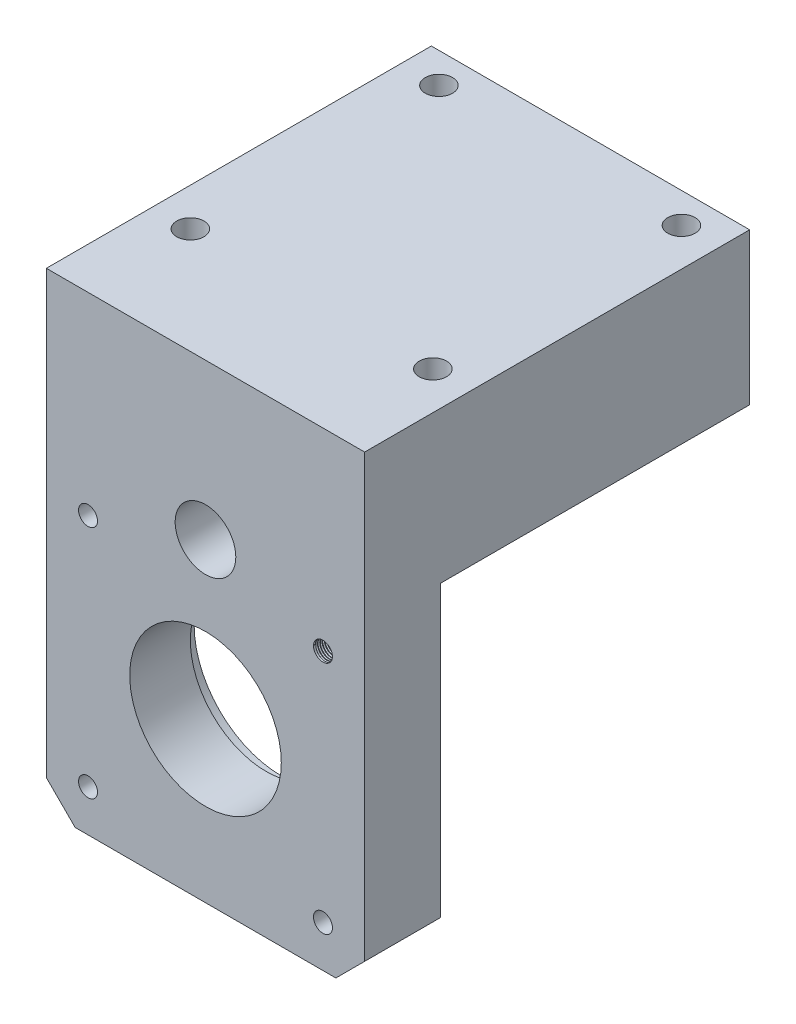
from build123d import *

# Parameters (mm, degrees)
SKETCH1_W                     = 42
SKETCH1_H                     = 42
SKETCH1_R                     = 1.25
SKETCH1_R_2                   = 11.5
BOSS_EXTRUDE1_DEPTH           = 2
SKETCH2_W                     = 42
SKETCH2_H                     = 42.8
BOSS_EXTRUDE2_DEPTH           = 15
SKETCH4_W                     = 42
SKETCH4_H                     = 57
SKETCH4_R                     = 1.25
SKETCH4_R_2                   = 10
BOSS_EXTRUDE9_DEPTH           = 8
SKETCH6_R                     = 4
CUT_EXTRUDE3_DEPTH            = 12
THREAD1_PITCH                 = 0.3
CHAMFER1_SIZE                 = 3.8
SKETCH7_W                     = 42
SKETCH7_H                     = 50.8
BOSS_EXTRUDE10_DEPTH          = 5
CSK_FOR_M3_SFHCS1_D           = 3.6
CSK_FOR_M3_SFHCS1_CSINK_D     = 6.72
CSK_FOR_M3_SFHCS1_CSINK_ANGLE = 90
MIRROR4_COPY_1_D              = 3.6
MIRROR4_COPY_1_CSINK_D        = 6.72
MIRROR4_COPY_1_CSINK_ANGLE    = 90


with BuildPart() as part:
    # Sketch1 → Boss-Extrude1 (new body)
    with BuildSketch(Plane.XY):
        Rectangle(SKETCH1_W, SKETCH1_H)
        with Locations((15.5, 15.5)):
            Circle(SKETCH1_R, mode=Mode.SUBTRACT)
        with Locations((-15.5, 15.5)):
            Circle(SKETCH1_R, mode=Mode.SUBTRACT)
        with Locations((-15.5, -15.5)):
            Circle(SKETCH1_R, mode=Mode.SUBTRACT)
        with Locations((15.5, -15.5)):
            Circle(SKETCH1_R, mode=Mode.SUBTRACT)
        Circle(SKETCH1_R_2, mode=Mode.SUBTRACT)
    extrude(amount=BOSS_EXTRUDE1_DEPTH)

    # Sketch2 → Boss-Extrude2 (add)
    with BuildSketch(Plane(origin=(0, 21, 0), x_dir=(1, 0, 0), z_dir=(0, 1, 0))):
        with Locations((0, 19.4)):
            Rectangle(SKETCH2_W, SKETCH2_H)
    extrude(amount=BOSS_EXTRUDE2_DEPTH)

    # Sketch4 → Boss-Extrude9 (add)
    with BuildSketch(Plane.XY.offset(2)):
        with Locations((0, 7.5)):
            Rectangle(SKETCH4_W, SKETCH4_H)
        with Locations((-15.5, -15.5)):
            Circle(SKETCH4_R, mode=Mode.SUBTRACT)
        with Locations((15.5, -15.5)):
            Circle(SKETCH4_R, mode=Mode.SUBTRACT)
        with Locations((15.5, 15.5)):
            Circle(SKETCH4_R, mode=Mode.SUBTRACT)
        with Locations((-15.5, 15.5)):
            Circle(SKETCH4_R, mode=Mode.SUBTRACT)
        Circle(SKETCH4_R_2, mode=Mode.SUBTRACT)
    extrude(amount=BOSS_EXTRUDE9_DEPTH)

    # Sketch6 → Cut-Extrude3 (cut)
    with BuildSketch(Plane.XY.offset(10)):
        with Locations((0, 20.5)):
            Circle(SKETCH6_R)
    extrude(amount=-CUT_EXTRUDE3_DEPTH, mode=Mode.SUBTRACT)

    # Thread1: the profile of Thread Profile1 profile screwed along a right-hand helix of 33.333333 turns, 6 arcs to a turn; built about Z, then put on its axis
    thread1_z = Axis((0, 0, 0), (0, 0, 1))
    thread1_corners = [(1.2497, 0, -0.000173205), (1.412379763, 0, 0.09375), (1.412379763, 0, 0.13125), (1.2497, 0, 0.225173204)]
    with BuildLine(mode=Mode.PRIVATE) as thread1_profile:
        Line(thread1_corners[0], thread1_corners[1])
        Line(thread1_corners[1], thread1_corners[2])
        Line(thread1_corners[2], thread1_corners[3])
        Line(thread1_corners[3], thread1_corners[0])
    thread1_cap = Face(thread1_profile.wire())
    thread1_turn_angles = [0, 30, 60, 90, 120, 150, 180, 210, 240, 270, 300, 330, 360]
    thread1_turn_weights = [1, 0.8660254037844387, 1, 0.8660254037844387, 1, 0.8660254037844387, 1, 0.8660254037844387, 1, 0.8660254037844387, 1, 0.8660254037844387, 1]
    thread1_turn_rails = [Edge.make_bspline([Vector(p[0], p[1], 0).rotate(thread1_z, thread1_turn_angles[k]) / thread1_turn_weights[k] + Vector(0, 0, p[2] + THREAD1_PITCH * thread1_turn_angles[k] / 360) for k in range(13)], [0, 0, 0, 1, 1, 2, 2, 3, 3, 4, 4, 5, 5, 6, 6, 6], 2, thread1_turn_weights) for p in thread1_corners]
    thread1_turn_sides = [Face.make_surface_from_curves(thread1_turn_rails[p[0]], thread1_turn_rails[p[1]]) for p in [(0, 1), (1, 2), (2, 3), (3, 0)]]
    thread1_last_angles = [11880, 11910, 11940, 11970, 12000]
    thread1_last_weights = [1, 0.8660254037844387, 1, 0.8660254037844387, 1]
    thread1_last_rails = [Edge.make_bspline([Vector(p[0], p[1], 0).rotate(thread1_z, thread1_last_angles[k]) / thread1_last_weights[k] + Vector(0, 0, p[2] + THREAD1_PITCH * thread1_last_angles[k] / 360) for k in range(5)], [0, 0, 0, 1, 1, 2, 2, 2], 2, thread1_last_weights) for p in thread1_corners]
    thread1_last_sides = [Face.make_surface_from_curves(thread1_last_rails[p[0]], thread1_last_rails[p[1]]) for p in [(0, 1), (1, 2), (2, 3), (3, 0)]]
    thread1 = Plane(origin=(15.5, 15.5, 10), x_dir=(-1, 0, 0), z_dir=(0, 0, -1)) * Solid(Shell([*[p.moved(Location((0, 0, THREAD1_PITCH * i))) for i in range(33) for p in thread1_turn_sides], *thread1_last_sides, thread1_cap, thread1_cap.rotate(thread1_z, 12000).moved(Location((0, 0, THREAD1_PITCH * 12000 / 360)))]))
    add(thread1, mode=Mode.SUBTRACT)

    # Chamfer1
    chamfer1_edges = [part.edges().sort_by_distance(p)[0] for p in [
        (21, -21, 5),
        (-21, -21, 5),
    ]]
    chamfer(chamfer1_edges, length=CHAMFER1_SIZE)

    # Sketch7 → Boss-Extrude10 (add)
    with BuildSketch(Plane(origin=(0, 36, 0), x_dir=(1, 0, 0), z_dir=(0, 1, 0))):
        with Locations((0, 15.4)):
            Rectangle(SKETCH7_W, SKETCH7_H)
    extrude(amount=BOSS_EXTRUDE10_DEPTH)

    # CSK for M3 SFHCS1 (through all)
    with Locations(Plane(origin=(0, 21, 0), x_dir=(-1, 0, 0), z_dir=(0, -1, 0))):
        with Locations((-16, 36.8)):
            csk_for_m3_sfhcs1 = CounterSinkHole(CSK_FOR_M3_SFHCS1_D / 2, CSK_FOR_M3_SFHCS1_CSINK_D / 2, counter_sink_angle=CSK_FOR_M3_SFHCS1_CSINK_ANGLE)

    # Mirror2: CSK for M3 SFHCS1 across plane
    add(csk_for_m3_sfhcs1.mirror(Plane(origin=(0, 0, 0), x_dir=(0, 0, 1), z_dir=(1, 0, 0))), mode=Mode.SUBTRACT)

    # Mirror4: CSK for M3 SFHCS1 across plane
    add(csk_for_m3_sfhcs1.mirror(Plane(origin=(0, 0, -20.4), x_dir=(1, 0, 0), z_dir=(0, 0, -1))), mode=Mode.SUBTRACT)

    # Mirror4 copy 1 (through all)
    with Locations(Plane(origin=(0, 21, -40.8), x_dir=(1, 0, 0), z_dir=(0, -1, 0))):
        with Locations((-16, 36.8)):
            CounterSinkHole(MIRROR4_COPY_1_D / 2, MIRROR4_COPY_1_CSINK_D / 2, counter_sink_angle=MIRROR4_COPY_1_CSINK_ANGLE)


solid = part.part
